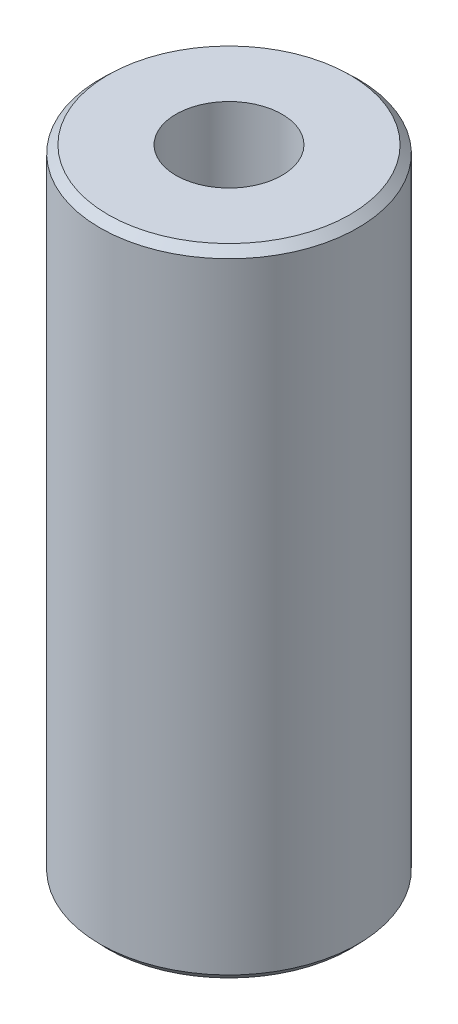
from build123d import *
from OCP.BRepFilletAPI import BRepFilletAPI_MakeChamfer

# Parameters (mm, degrees)
SKETCH1_R           = 60
BOSS_EXTRUDE1_DEPTH = 295.857203789
SKETCH2_R           = 24.674974114
CUT_EXTRUDE1_DEPTH  = 308.784803123
CHAMFER1_SIZE       = 3.513929038
CHAMFER1_SIZE2      = 3.696098076


with BuildPart() as part:
    # Sketch1 → Boss-Extrude1 (new body)
    with BuildSketch(Plane(origin=(0, 0, 0), x_dir=(1, 0, 0), z_dir=(0, 1, 0))):
        Circle(SKETCH1_R)
    extrude(amount=BOSS_EXTRUDE1_DEPTH)

    # Sketch2 → Cut-Extrude1 (cut, through all)
    with BuildSketch(Plane(origin=(0, 0, 0), x_dir=(1, 0, 0), z_dir=(0, 1, 0))):
        Circle(SKETCH2_R)
    extrude(amount=CUT_EXTRUDE1_DEPTH, mode=Mode.SUBTRACT)

    # Chamfer1: one chamfer whose edges measure the first distance from different faces: ONE call of the kernel's chamfer builder (chamfer() names one face for all edges)
    chamfer1_edges_1 = [part.edges().sort_by_distance(p)[0] for p in [
        (-60, 295.857203789, 0),
    ]]
    chamfer1_side_1 = [part.faces().sort_by_distance(p)[0] for p in [
        (-60, 147.928601894, 0),
    ]]
    chamfer1_edges_2 = [part.edges().sort_by_distance(p)[0] for p in [
        (-60, 0, 0),
    ]]
    chamfer1_side_2 = [part.faces().sort_by_distance(p)[0] for p in [
        (-58.302943725, 0, 0),
    ]]
    chamfer1 = BRepFilletAPI_MakeChamfer(part.part.solid().wrapped)
    for e in chamfer1_edges_1:
        chamfer1.Add(CHAMFER1_SIZE, CHAMFER1_SIZE2, e.wrapped, chamfer1_side_1[0].wrapped)  # the first distance lies on this face
    for e in chamfer1_edges_2:
        chamfer1.Add(CHAMFER1_SIZE, CHAMFER1_SIZE2, e.wrapped, chamfer1_side_2[0].wrapped)  # the first distance lies on this face
    add(Compound.cast(chamfer1.Shape()), mode=Mode.REPLACE)


solid = part.part
